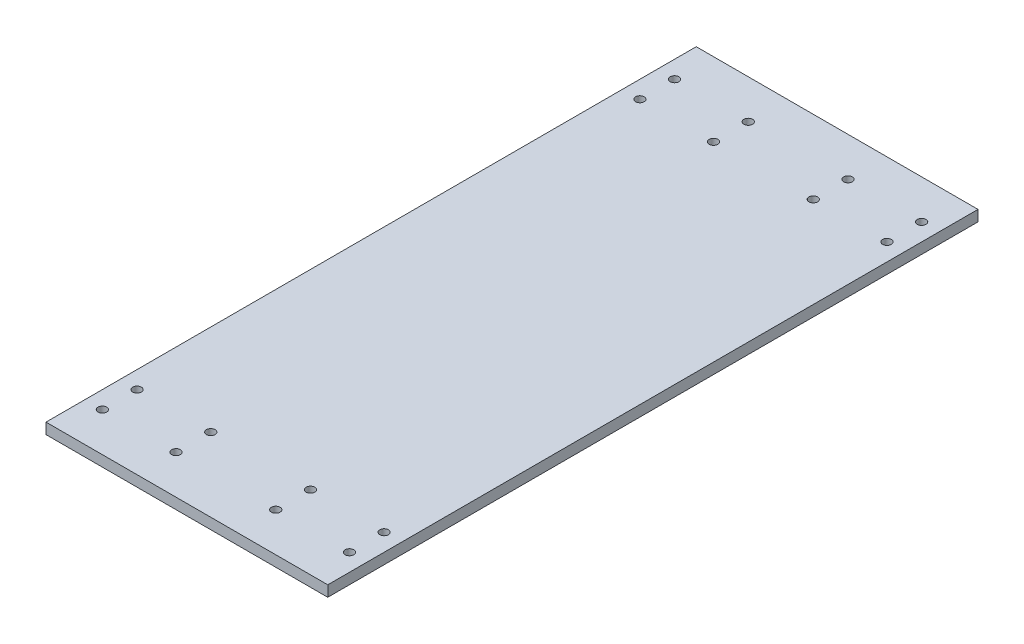
from build123d import *

# Parameters (mm, degrees)
SKETCH2_W                                  = 130
SKETCH2_H                                  = 300
BOSS_EXTRUDE1_DEPTH                        = 5
SKETCH3_R                                  = 2
CUT_EXTRUDE1_DEPTH                         = 10
MIRROR1_AT_THE_SECOND_PLANE_COPY_1_SKETC_R = 2
MIRROR1_AT_THE_SECOND_PLANE_COPY_1_DEPTH   = 10


with BuildPart() as part:
    # Sketch2 → Boss-Extrude1 (new body)
    with BuildSketch(Plane(origin=(0, 0, 0), x_dir=(1, 0, 0), z_dir=(0, 1, 0))):
        Rectangle(SKETCH2_W, SKETCH2_H)
    extrude(amount=BOSS_EXTRUDE1_DEPTH)

    # Sketch3 → Cut-Extrude1 (cut)
    with BuildSketch(Plane(origin=(0, 5, 0), x_dir=(1, 0, 0), z_dir=(0, 1, 0))):
        with Locations((-57, 132)):
            Circle(SKETCH3_R)
        with Locations((-57, 116)):
            Circle(SKETCH3_R)
        with Locations((-23, 132)):
            Circle(SKETCH3_R)
        with Locations((-23, 116)):
            Circle(SKETCH3_R)
    cut_extrude1 = extrude(amount=-CUT_EXTRUDE1_DEPTH, mode=Mode.SUBTRACT)

    # Mirror1: Cut-Extrude1 across plane
    add(cut_extrude1.mirror(Plane.XY), mode=Mode.SUBTRACT)

    # Mirror1 at the second plane: Cut-Extrude1 across plane
    add(cut_extrude1.mirror(Plane(origin=(0, 0, 0), x_dir=(0, 0, 1), z_dir=(1, 0, 0))), mode=Mode.SUBTRACT)

    # Mirror1 at the second plane copy 1 sketc → Mirror1 at the second plane copy 1 (cut)
    with BuildSketch(Plane(origin=(0, 5, 0), x_dir=(-1, 0, 0), z_dir=(0, 1, 0))):
        with Locations((-57, 132)):
            Circle(MIRROR1_AT_THE_SECOND_PLANE_COPY_1_SKETC_R)
        with Locations((-57, 116)):
            Circle(MIRROR1_AT_THE_SECOND_PLANE_COPY_1_SKETC_R)
        with Locations((-23, 132)):
            Circle(MIRROR1_AT_THE_SECOND_PLANE_COPY_1_SKETC_R)
        with Locations((-23, 116)):
            Circle(MIRROR1_AT_THE_SECOND_PLANE_COPY_1_SKETC_R)
    extrude(amount=-MIRROR1_AT_THE_SECOND_PLANE_COPY_1_DEPTH, mode=Mode.SUBTRACT)


solid = part.part
